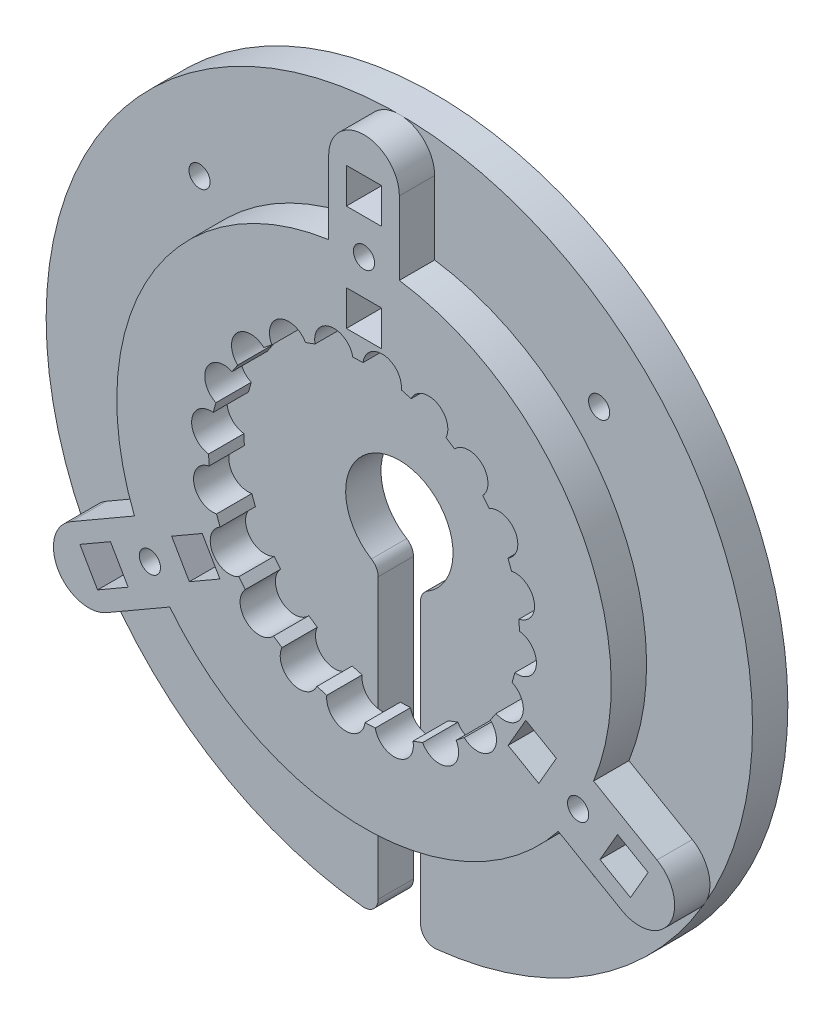
from build123d import *

# Parameters (mm, degrees)
BODY_MOVE_COPY2_START     = 18.4153099
BODY_MOVE_COPY2_OUTLINE_R = 1.5
BODY_MOVE_COPY2_OUTLINE_W = 5
BODY_MOVE_COPY2_OUTLINE_H = 5
BODY_MOVE_COPY2_DEPTH     = 5
SKETCH2_R                 = 1.5
SKETCH2_W                 = 5
SKETCH2_H                 = 5
BOSS_EXTRUDE1_DEPTH       = 5
CUT_EXTRUDE1_DEPTH        = 10


# Read off the part's stored shape, not the designer's step: Body-Move/Copy2
with BuildPart() as part:
    # Body-Move/Copy2 outline → Body-Move/Copy2 (new body)
    with BuildSketch(Plane.XY.offset(BODY_MOVE_COPY2_START)):
        with BuildLine():
            ThreePointArc((-29.993059319, -14.335142591), (-30.249021858, -13.35619758), (-30.951392653, -12.62782582))
            ThreePointArc((-30.951392653, -12.62782582), (-26.993059319, 1.459977909), (-23.034725986, -12.62782582))
            ThreePointArc((-23.034725986, -12.62782582), (-23.737096781, -13.35619758), (-23.993059319, -14.335142591))
            Line((-23.993059319, -14.335142591), (-23.993059319, -53.87889514))
            ThreePointArc((-23.993059319, -53.87889514), (-23.331590853, -55.364941349), (-21.784725986, -55.868014851))
            ThreePointArc((-21.784725986, -55.868014851), (-26.993059319, 43.859977909), (-32.201392653, -55.868014851))
            ThreePointArc((-32.201392653, -55.868014851), (-30.654527786, -55.364941349), (-29.993059319, -53.87889514))
            Line((-29.993059319, -53.87889514), (-29.993059319, -14.335142591))
        make_face()
        with Locations((-55.277330567, -34.424293339)):
            Circle(BODY_MOVE_COPY2_OUTLINE_R, mode=Mode.SUBTRACT)
        Polygon((-67.21420249, -26.474958582), (-62.884075471, -23.974958582), (-60.384075471, -28.305085601), (-64.71420249, -30.805085601), align=None, mode=Mode.SUBTRACT)
        with Locations((-57.303948452, -23.640022091)):
            Circle(BODY_MOVE_COPY2_OUTLINE_R, mode=Mode.SUBTRACT)
        Polygon((-47.393694414, -20.805085601), (-51.723821433, -23.305085601), (-54.223821433, -18.974958582), (-49.893694414, -16.474958582), align=None, mode=Mode.SUBTRACT)
        with Locations((1.291211928, -34.424293339)):
            Circle(BODY_MOVE_COPY2_OUTLINE_R, mode=Mode.SUBTRACT)
        Polygon((-4.092424225, -16.474958582), (0.237702794, -18.974958582), (-2.262297206, -23.305085601), (-6.592424225, -20.805085601), align=None, mode=Mode.SUBTRACT)
        Polygon((10.728083851, -30.805085601), (6.397956832, -28.305085601), (8.897956832, -23.974958582), (13.228083851, -26.474958582), align=None, mode=Mode.SUBTRACT)
        with Locations((3.317829813, -23.640022091)):
            Circle(BODY_MOVE_COPY2_OUTLINE_R, mode=Mode.SUBTRACT)
        with Locations((-55.277330567, 22.144249156)):
            Circle(BODY_MOVE_COPY2_OUTLINE_R, mode=Mode.SUBTRACT)
        with Locations((-26.993059319, 21.359977909)):
            Rectangle(BODY_MOVE_COPY2_OUTLINE_W, BODY_MOVE_COPY2_OUTLINE_H, mode=Mode.SUBTRACT)
        with Locations((-26.993059319, 28.859977909)):
            Circle(BODY_MOVE_COPY2_OUTLINE_R, mode=Mode.SUBTRACT)
        with Locations((-26.993059319, 36.359977909)):
            Rectangle(BODY_MOVE_COPY2_OUTLINE_W, BODY_MOVE_COPY2_OUTLINE_H, mode=Mode.SUBTRACT)
        with Locations((1.291211928, 22.144249156)):
            Circle(BODY_MOVE_COPY2_OUTLINE_R, mode=Mode.SUBTRACT)
    extrude(amount=BODY_MOVE_COPY2_DEPTH)


with BuildPart() as body_2:
    # Sketch2 → Boss-Extrude1 (new body)
    with BuildSketch(Plane.XY.offset(23.4153099)):
        with BuildLine():
            Line((-68.46420249, -24.309895072), (-59.493059319, -19.130403148))
            ThreePointArc((-59.493059319, -19.130403148), (-57.303948452, 11.359977909), (-31.993059319, 28.50099406))
            Line((-31.993059319, 28.50099406), (-31.993059319, 38.859977909))
            ThreePointArc((-31.993059319, 38.859977909), (-26.993059319, 43.859977909), (-21.993059319, 38.859977909))
            Line((-21.993059319, 38.859977909), (-21.993059319, 28.50099406))
            ThreePointArc((-21.993059319, 28.50099406), (3.317829813, 11.359977909), (5.506940681, -19.130403148))
            Line((5.506940681, -19.130403148), (14.478083851, -24.309895072))
            ThreePointArc((14.478083851, -24.309895072), (16.30821087, -31.140022091), (9.478083851, -32.97014911))
            Line((9.478083851, -32.97014911), (0.506940681, -27.790657186))
            ThreePointArc((0.506940681, -27.790657186), (-26.993059319, -41.140022091), (-54.493059319, -27.790657186))
            Line((-54.493059319, -27.790657186), (-63.46420249, -32.97014911))
            ThreePointArc((-63.46420249, -32.97014911), (-70.294329509, -31.140022091), (-68.46420249, -24.309895072))
        make_face()
        with Locations((-26.993059319, 28.859977909)):
            Circle(SKETCH2_R, mode=Mode.SUBTRACT)
        with Locations((3.317829813, -23.640022091)):
            Circle(SKETCH2_R, mode=Mode.SUBTRACT)
        with Locations((-57.303948452, -23.640022091)):
            Circle(SKETCH2_R, mode=Mode.SUBTRACT)
        with Locations((-26.993059319, 36.359977909)):
            Rectangle(SKETCH2_W, SKETCH2_H, mode=Mode.SUBTRACT)
        with Locations((-26.993059319, 21.359977909)):
            Rectangle(SKETCH2_W, SKETCH2_H, mode=Mode.SUBTRACT)
        Polygon((0.237702794, -18.974958582), (-4.092424225, -16.474958582), (-6.592424225, -20.805085601), (-2.262297206, -23.305085601), align=None, mode=Mode.SUBTRACT)
        Polygon((8.897956832, -23.974958582), (13.228083851, -26.474958582), (10.728083851, -30.805085601), (6.397956832, -28.305085601), align=None, mode=Mode.SUBTRACT)
        Polygon((-62.884075471, -23.974958582), (-67.21420249, -26.474958582), (-64.71420249, -30.805085601), (-60.384075471, -28.305085601), align=None, mode=Mode.SUBTRACT)
        Polygon((-54.223821433, -18.974958582), (-49.893694414, -16.474958582), (-47.393694414, -20.805085601), (-51.723821433, -23.305085601), align=None, mode=Mode.SUBTRACT)
    extrude(amount=BOSS_EXTRUDE1_DEPTH)

    # Sketch3 → Cut-Extrude1 (cut)
    with BuildSketch(Plane.XY.offset(28.4153099)):
        with BuildLine():
            Line((-45.677523519, 5.474227673), (-44.872461508, 6.678986349))
            ThreePointArc((-44.872461508, 6.678986349), (-45.023559076, 10.528505229), (-41.174040195, 10.679602797))
            Line((-41.174040195, 10.679602797), (-40.036089819, 11.576618544))
            ThreePointArc((-40.036089819, 11.576618544), (-38.990225392, 15.284420276), (-35.282423659, 14.238555848))
            Line((-35.282423659, 14.238555848), (-33.922975429, 14.740022514))
            ThreePointArc((-33.922975429, 14.740022514), (-31.782525503, 17.943161631), (-28.579386386, 15.802711705))
            Line((-28.579386386, 15.802711705), (-27.131512567, 15.859542239))
            ThreePointArc((-27.131512567, 15.859542239), (-24.105999294, 18.244473165), (-21.721068368, 15.218959893))
            Line((-21.721068368, 15.218959893), (-20.326496936, 14.825591327))
            ThreePointArc((-20.326496936, 14.825591327), (-16.712078636, 16.158860408), (-15.378809555, 12.544442108))
            Line((-15.378809555, 12.544442108), (-14.174050879, 11.739380097))
            ThreePointArc((-14.174050879, 11.739380097), (-10.324531999, 11.890477665), (-10.173434431, 8.040958785))
            Line((-10.173434431, 8.040958785), (-9.276418685, 6.903008409))
            ThreePointArc((-9.276418685, 6.903008409), (-5.568616952, 5.857143981), (-6.61448138, 2.149342249))
            Line((-6.61448138, 2.149342249), (-6.113014714, 0.789894019))
            ThreePointArc((-6.113014714, 0.789894019), (-2.909875598, -1.350555907), (-5.050325523, -4.553695024))
            Line((-5.050325523, -4.553695024), (-4.99349499, -6.001568844))
            ThreePointArc((-4.99349499, -6.001568844), (-2.608564063, -9.027082116), (-5.634077335, -11.412013043))
            Line((-5.634077335, -11.412013043), (-6.027445902, -12.806584475))
            ThreePointArc((-6.027445902, -12.806584475), (-4.694176821, -16.421002774), (-8.30859512, -17.754271855))
            Line((-8.30859512, -17.754271855), (-9.113657131, -18.959030531))
            ThreePointArc((-9.113657131, -18.959030531), (-8.962559563, -22.808549412), (-12.812078443, -22.95964698))
            Line((-12.812078443, -22.95964698), (-13.95002882, -23.856662726))
            ThreePointArc((-13.95002882, -23.856662726), (-14.995893247, -27.564464458), (-18.703694979, -26.518600031))
            Line((-18.703694979, -26.518600031), (-20.06314321, -27.020066696))
            ThreePointArc((-20.06314321, -27.020066696), (-22.203593136, -30.223205813), (-25.406732252, -28.082755887))
            Line((-25.406732252, -28.082755887), (-26.854606072, -28.139586421))
            ThreePointArc((-26.854606072, -28.139586421), (-29.880119344, -30.524517348), (-32.265050271, -27.499004075))
            Line((-32.265050271, -27.499004075), (-33.659621703, -27.105635509))
            ThreePointArc((-33.659621703, -27.105635509), (-37.274040003, -28.43890459), (-38.607309084, -24.82448629))
            Line((-38.607309084, -24.82448629), (-39.812067759, -24.01942428))
            ThreePointArc((-39.812067759, -24.01942428), (-43.66158664, -24.170521848), (-43.812684208, -20.321002967))
            Line((-43.812684208, -20.321002967), (-44.709699954, -19.183052591))
            ThreePointArc((-44.709699954, -19.183052591), (-48.417501686, -18.137188164), (-47.371637259, -14.429386431))
            Line((-47.371637259, -14.429386431), (-47.873103924, -13.069938201))
            ThreePointArc((-47.873103924, -13.069938201), (-51.076243041, -10.929488275), (-48.935793115, -7.726349158))
            Line((-48.935793115, -7.726349158), (-48.992623649, -6.278475338))
            ThreePointArc((-48.992623649, -6.278475338), (-51.377554576, -3.252962066), (-48.352041304, -0.868031139))
            Line((-48.352041304, -0.868031139), (-47.958672737, 0.526540293))
            ThreePointArc((-47.958672737, 0.526540293), (-49.291941818, 4.140958592), (-45.677523519, 5.474227673))
        make_face()
    extrude(amount=-CUT_EXTRUDE1_DEPTH, mode=Mode.SUBTRACT)


solid = Compound([part.part, body_2.part])
